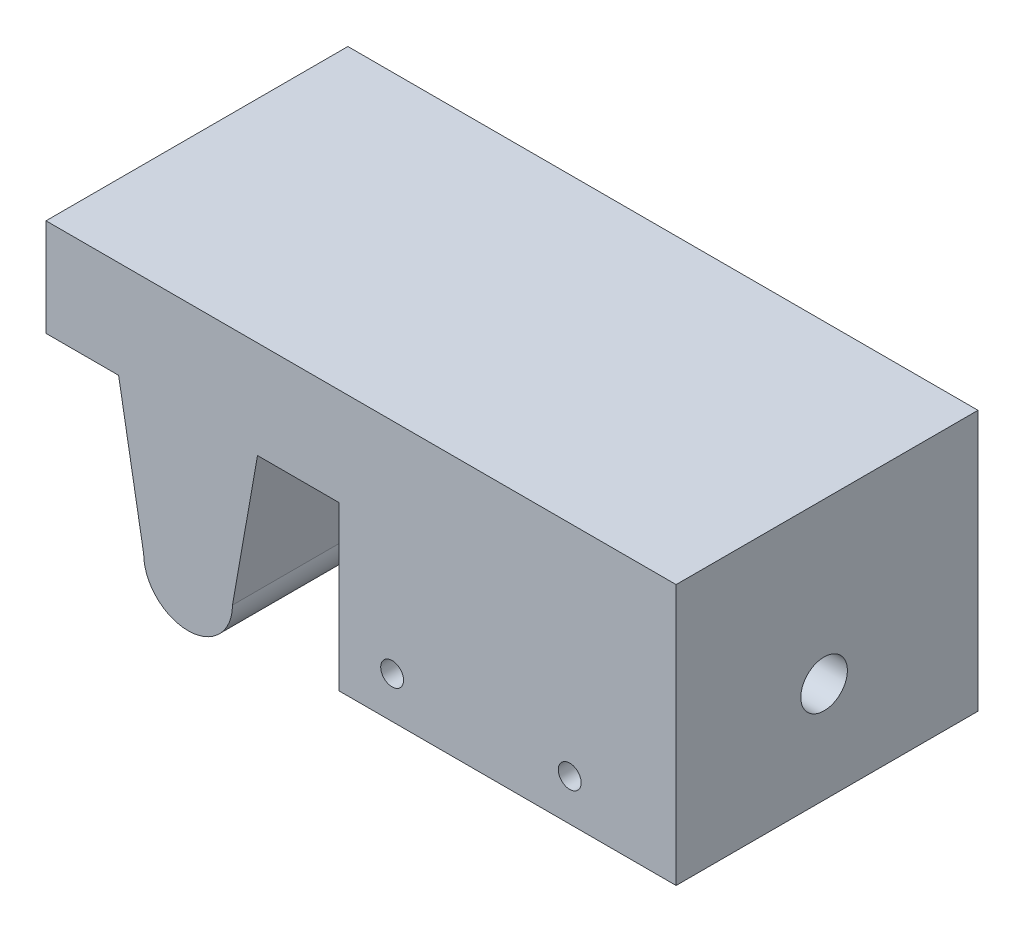
from build123d import *
from build123d.topology import SkipClean

# Parameters (mm, degrees)
SKETCH1_W             = 48
SKETCH1_H             = 53
BOSS_EXTRUDE1_DEPTH   = 10
SKETCH2_W             = 48
SKETCH2_H             = 5.616325
BOSS_EXTRUDE2_DEPTH   = 33.1917878
SKETCH4_W             = 4
SKETCH4_H             = 10
BOSS_EXTRUDE4_DEPTH   = 40
SKETCH5_W             = 48
SKETCH5_H             = 10.8609375
BOSS_EXTRUDE5_DEPTH   = 23.1917878
SKETCH6_W             = 48
SKETCH6_H             = 5
BOSS_EXTRUDE6_DEPTH   = 42.3
SKETCH7_W             = 12.8082122
SKETCH7_H             = 16.4772625
BOSS_EXTRUDE7_DEPTH   = 48
CUT_EXTRUDE1_REACH    = 84.426
SKETCH8_R             = 11.5
SKETCH8_R_2           = 2
FILLET1_R             = 10
FILLET2_R             = 4
SKETCH9_W             = 5
SKETCH9_H             = 16.4772625
BOSS_EXTRUDE9_DEPTH   = 48
CUT_EXTRUDE2_DEPTH    = 88.252507127
SKETCH11_W            = 51
SKETCH11_H            = 16.4772625
BOSS_EXTRUDE10_DEPTH  = 49.45
BOSS_EXTRUDE11_DEPTH  = 46
SKETCH16_W            = 47.95
SKETCH16_H            = 51
BOSS_EXTRUDE14_DEPTH  = 2.55
SKETCH14_W            = 5
SKETCH14_H            = 42.3
BOSS_EXTRUDE13_DEPTH  = 1.5
SKETCH17_W            = 51
SKETCH17_H            = 19.0272625
BOSS_EXTRUDE15_DEPTH  = 9
BOSS_EXTRUDE16_DEPTH  = 25
SKETCH19_R            = 1.9304
CUT_EXTRUDE3_DEPTH    = 125.404890183
MIRROR2_START         = 33.1917878
MIRROR2_DEPTH         = 51
MIRROR2_START_2       = 76.1917878
MIRROR2_2_OUTLINE_W   = 47.95
MIRROR2_2_OUTLINE_H   = 25
MIRROR2_2_OUTLINE_R   = 1.9304
MIRROR2_2_DEPTH       = 8
MIRROR2_3_OUTLINE_W   = 45
MIRROR2_3_OUTLINE_H   = 42.3
MIRROR2_3_OUTLINE_R   = 2
MIRROR2_3_OUTLINE_R_2 = 11.5
MIRROR2_3_DEPTH       = 5
SKETCH20_W            = 103.287975037
SKETCH20_H            = 97.84889924
CUT_EXTRUDE4_DEPTH    = 144.929961559
SKETCH21_W            = 49.5
SKETCH21_H            = 42.3
CUT_EXTRUDE5_DEPTH    = 128.391431036
SKETCH24_R            = 7.5
BOSS_EXTRUDE18_DEPTH  = 45
BOSS_EXTRUDE19_DEPTH  = 29
SKETCH26_R            = 3.937
CUT_EXTRUDE6_DEPTH    = 135.023808387


# Read off the part's stored shape, not the designer's step: Mirror2
with BuildPart() as part:
    # Sketch1 → Boss-Extrude1 (new body)
    with BuildSketch(Plane.XY):
        with Locations((24, 26.5)):
            Rectangle(SKETCH1_W, SKETCH1_H)
    extrude(amount=BOSS_EXTRUDE1_DEPTH)

    # Sketch2 → Boss-Extrude2 (add)
    with BuildSketch(Plane(origin=(0, 0, 0), x_dir=(-1, 0, 0), z_dir=(0, 0, -1))):
        with Locations((-24, -2.8081625)):
            Rectangle(SKETCH2_W, SKETCH2_H)
    extrude(amount=-BOSS_EXTRUDE2_DEPTH)

    # Sketch4 → Boss-Extrude4 (add)
    with BuildSketch(Plane.XY.offset(10)):
        with Locations((2, 48)):
            Rectangle(SKETCH4_W, SKETCH4_H)
        with Locations((46, 48)):
            Rectangle(SKETCH4_W, SKETCH4_H)
    extrude(amount=BOSS_EXTRUDE4_DEPTH)

    # Sketch5 → Boss-Extrude5 (add)
    with BuildSketch(Plane.XY.offset(10)):
        with Locations((24, 5.43046875)):
            Rectangle(SKETCH5_W, SKETCH5_H)
    extrude(amount=BOSS_EXTRUDE5_DEPTH)

    # Sketch6 → Boss-Extrude6 (add)
    with BuildSketch(Plane.XZ.offset(5.616325)):
        with Locations((24, 30.6917878)):
            Rectangle(SKETCH6_W, SKETCH6_H)
    extrude(amount=BOSS_EXTRUDE6_DEPTH)

    # Sketch7 → Boss-Extrude7 (add)
    with BuildSketch(Plane.ZY):
        with Locations((-6.4041061, 2.62230625)):
            Rectangle(SKETCH7_W, SKETCH7_H)
    extrude(amount=-BOSS_EXTRUDE7_DEPTH)

    # Sketch8 → Cut-Extrude1 (cut, up to next)
    with BuildSketch(Plane(origin=(0, 0, 28.1917878), x_dir=(-1, 0, 0), z_dir=(0, 0, -1)), mode=Mode.PRIVATE) as cut_extrude1_sk1:
        with Locations((-24, -26.616325)):
            Circle(SKETCH8_R)
    cut_extrude1_tool1 = extrude(cut_extrude1_sk1.sketch, amount=-CUT_EXTRUDE1_REACH, mode=Mode.PRIVATE) & part.part
    # Sketch8 → Cut-Extrude1 (cut, up to next)
    with BuildSketch(Plane(origin=(0, 0, 28.1917878), x_dir=(-1, 0, 0), z_dir=(0, 0, -1)), mode=Mode.PRIVATE) as cut_extrude1_sk2:
        with Locations((-39.5, -11.116325)):
            Circle(SKETCH8_R_2)
    cut_extrude1_tool2 = extrude(cut_extrude1_sk2.sketch, amount=-CUT_EXTRUDE1_REACH, mode=Mode.PRIVATE) & part.part
    # Sketch8 → Cut-Extrude1 (cut, up to next)
    with BuildSketch(Plane(origin=(0, 0, 28.1917878), x_dir=(-1, 0, 0), z_dir=(0, 0, -1)), mode=Mode.PRIVATE) as cut_extrude1_sk3:
        with Locations((-39.5, -42.116325)):
            Circle(SKETCH8_R_2)
    cut_extrude1_tool3 = extrude(cut_extrude1_sk3.sketch, amount=-CUT_EXTRUDE1_REACH, mode=Mode.PRIVATE) & part.part
    # Sketch8 → Cut-Extrude1 (cut, up to next)
    with BuildSketch(Plane(origin=(0, 0, 28.1917878), x_dir=(-1, 0, 0), z_dir=(0, 0, -1)), mode=Mode.PRIVATE) as cut_extrude1_sk4:
        with Locations((-8.5, -11.116325)):
            Circle(SKETCH8_R_2)
    cut_extrude1_tool4 = extrude(cut_extrude1_sk4.sketch, amount=-CUT_EXTRUDE1_REACH, mode=Mode.PRIVATE) & part.part
    # Sketch8 → Cut-Extrude1 (cut, up to next)
    with BuildSketch(Plane(origin=(0, 0, 28.1917878), x_dir=(-1, 0, 0), z_dir=(0, 0, -1)), mode=Mode.PRIVATE) as cut_extrude1_sk5:
        with Locations((-8.5, -42.116325)):
            Circle(SKETCH8_R_2)
    cut_extrude1_tool5 = extrude(cut_extrude1_sk5.sketch, amount=-CUT_EXTRUDE1_REACH, mode=Mode.PRIVATE) & part.part
    add(cut_extrude1_tool1.solids().sort_by_distance((24, -26.616325, 28.191788))[0], mode=Mode.SUBTRACT)
    add(cut_extrude1_tool2.solids().sort_by_distance((39.5, -11.116325, 28.191788))[0], mode=Mode.SUBTRACT)
    add(cut_extrude1_tool3.solids().sort_by_distance((39.5, -42.116325, 28.191788))[0], mode=Mode.SUBTRACT)
    add(cut_extrude1_tool4.solids().sort_by_distance((8.5, -11.116325, 28.191788))[0], mode=Mode.SUBTRACT)
    add(cut_extrude1_tool5.solids().sort_by_distance((8.5, -42.116325, 28.191788))[0], mode=Mode.SUBTRACT)

    # Fillet1
    fillet1_edges = [part.edges().sort_by_distance(p)[0] for p in [
        (24, 10.8609375, 0),
    ]]
    fillet(fillet1_edges, radius=FILLET1_R)

    # Fillet2
    fillet2_edges = [part.edges().sort_by_distance(p)[0] for p in [
        (2, 43, 10),
        (46, 43, 10),
    ]]
    fillet(fillet2_edges, radius=FILLET2_R)

    # Sketch9 → Boss-Extrude9 (add)
    with BuildSketch(Plane(origin=(48, 0, 0), x_dir=(0, 0, -1), z_dir=(1, 0, 0))):
        with Locations((15.3082122, 2.62230625)):
            Rectangle(SKETCH9_W, SKETCH9_H)
    extrude(amount=-BOSS_EXTRUDE9_DEPTH)

    # Sketch10 → Cut-Extrude2 (cut, through all)
    with BuildSketch(Plane(origin=(48, 0, 0), x_dir=(0, 0, -1), z_dir=(1, 0, 0))):
        Polygon((17.8082122, 10.8609375), (-33.1917878, 10.8609375), (-76.887145623, 43.902095521), (-50.794096938, 74.436514195), (27.207463492, 71.105486703), align=None)
    extrude(amount=-CUT_EXTRUDE2_DEPTH, mode=Mode.SUBTRACT)

    # Sketch11 → Boss-Extrude10 (add)
    with BuildSketch(Plane(origin=(48, 0, 0), x_dir=(0, 0, -1), z_dir=(1, 0, 0))):
        with Locations((-7.6917878, 2.62230625)):
            Rectangle(SKETCH11_W, SKETCH11_H)
    extrude(amount=BOSS_EXTRUDE10_DEPTH)

    # Sketch12 → Boss-Extrude11 (add)
    with BuildSketch(Plane(origin=(0, 0, 28.1917878), x_dir=(-1, 0, 0), z_dir=(0, 0, -1))):
        Polygon((-48, -47.916325), (-45, -47.916325), (-45, -5.616325), (-49.5, -5.616325), (-49.5, -47.916325), align=None)
    extrude(amount=BOSS_EXTRUDE11_DEPTH)

    # Sketch16 → Boss-Extrude14 (add)
    with BuildSketch(Plane.XZ.offset(5.616325)):
        with Locations((73.475, 7.6917878)):
            Rectangle(SKETCH16_W, SKETCH16_H)
    extrude(amount=BOSS_EXTRUDE14_DEPTH)

    # Sketch14 → Boss-Extrude13 (add)
    with BuildSketch(Plane(origin=(49.5, 0, 0), x_dir=(0, 0, -1), z_dir=(1, 0, 0))):
        with Locations((-30.6917878, -26.766325)):
            Rectangle(SKETCH14_W, SKETCH14_H)
    extrude(amount=-BOSS_EXTRUDE13_DEPTH)

    # Sketch17 → Boss-Extrude15 (add)
    with BuildSketch(Plane(origin=(97.45, 0, 0), x_dir=(0, 0, -1), z_dir=(1, 0, 0))):
        with Locations((-7.6917878, 1.34730625)):
            Rectangle(SKETCH17_W, SKETCH17_H)
    extrude(amount=BOSS_EXTRUDE15_DEPTH)

    # Sketch18 → Boss-Extrude16 (add)
    with BuildSketch(Plane.XZ.offset(8.166325)):
        Polygon((49.5, -17.8082122), (106.45, -17.8082122), (106.45, -9.8082122), (106.45, 33.1917878), (97.45, 33.1917878), (97.45, -9.8082122), (49.5, -9.8082122), align=None)
    extrude(amount=BOSS_EXTRUDE16_DEPTH)

    # Sketch19 → Cut-Extrude3 (cut, through all)
    with BuildSketch(Plane.XY.offset(-9.8082122)):
        with Locations((58.475, -26.166325)):
            Circle(SKETCH19_R)
        with Locations((88.475, -26.166325)):
            Circle(SKETCH19_R)
    extrude(amount=-CUT_EXTRUDE3_DEPTH, mode=Mode.SUBTRACT)

    # Mirror2 outline → Mirror2 (add)
    with BuildSketch(Plane.XY.offset(MIRROR2_START)):
        Polygon((49.5, -47.916325), (49.5, -8.166325), (97.45, -8.166325), (97.45, -33.166325), (106.45, -33.166325), (106.45, 10.8609375), (0, 10.8609375), (0, -5.616325), (45, -5.616325), (45, -47.916325), align=None)
    extrude(amount=MIRROR2_DEPTH)

    # Mirror2 2 outline → Mirror2 2 (add)
    with BuildSketch(Plane.XY.offset(MIRROR2_START_2)):
        with Locations((73.475, -20.666325)):
            Rectangle(MIRROR2_2_OUTLINE_W, MIRROR2_2_OUTLINE_H)
        with Locations((58.475, -26.166325)):
            Circle(MIRROR2_2_OUTLINE_R, mode=Mode.SUBTRACT)
        with Locations((88.475, -26.166325)):
            Circle(MIRROR2_2_OUTLINE_R, mode=Mode.SUBTRACT)
    extrude(amount=MIRROR2_2_DEPTH)

    # Mirror2 3 outline → Mirror2 3 (add)
    with SkipClean():  # the faces are left unmerged after this step: merging them gives an invalid solid
        with BuildSketch(Plane.XY.offset(MIRROR2_START)):
            with Locations((22.5, -26.766325)):
                Rectangle(MIRROR2_3_OUTLINE_W, MIRROR2_3_OUTLINE_H)
            with Locations((8.5, -42.116325)):
                Circle(MIRROR2_3_OUTLINE_R, mode=Mode.SUBTRACT)
            with Locations((39.5, -42.116325)):
                Circle(MIRROR2_3_OUTLINE_R, mode=Mode.SUBTRACT)
            with Locations((24, -26.616325)):
                Circle(MIRROR2_3_OUTLINE_R_2, mode=Mode.SUBTRACT)
            with Locations((8.5, -11.116325)):
                Circle(MIRROR2_3_OUTLINE_R, mode=Mode.SUBTRACT)
            with Locations((39.5, -11.116325)):
                Circle(MIRROR2_3_OUTLINE_R, mode=Mode.SUBTRACT)
        extrude(amount=MIRROR2_3_DEPTH)

    # Sketch20 → Cut-Extrude4 (cut, through all)
    with BuildSketch(Plane.ZY):
        with Locations((-18.452199719, -38.06351212)):
            Rectangle(SKETCH20_W, SKETCH20_H)
    extrude(amount=-CUT_EXTRUDE4_DEPTH, mode=Mode.SUBTRACT)

    # Sketch21 → Cut-Extrude5 (cut, through all)
    with BuildSketch(Plane.XY.offset(84.1917878)):
        with Locations((24.75, -26.766325)):
            Rectangle(SKETCH21_W, SKETCH21_H)
    extrude(amount=-CUT_EXTRUDE5_DEPTH, mode=Mode.SUBTRACT)



with BuildPart() as body_2:
    # Sketch24 → Boss-Extrude18 (new body)
    with BuildSketch(Plane.XY.offset(55.1917878)):
        with Locations((24, -29.616325)):
            Circle(SKETCH24_R)
    extrude(amount=-BOSS_EXTRUDE18_DEPTH)


with BuildPart() as part_1:
    add(part.part)

    add(body_2.part)  # Boss-Extrude19 merges body 2
    # Sketch25 → Boss-Extrude19 (add)
    with BuildSketch(Plane.XY.offset(55.1917878)):
        with BuildLine():
            Line((16.5, -29.616325), (12.268152463, -5.616325))
            Line((12.268152463, -5.616325), (35.731847537, -5.616325))
            Line((35.731847537, -5.616325), (31.5, -29.616325))
            ThreePointArc((31.5, -29.616325), (24, -37.116325), (16.5, -29.616325))
        make_face()
    extrude(amount=BOSS_EXTRUDE19_DEPTH)

    # Sketch26 → Cut-Extrude6 (cut, through all)
    with BuildSketch(Plane.ZY.offset(-97.45)):
        with Locations((59.1917878, -16.166325)):
            Circle(SKETCH26_R)
    extrude(amount=-CUT_EXTRUDE6_DEPTH, mode=Mode.SUBTRACT)


solid = part_1.part
